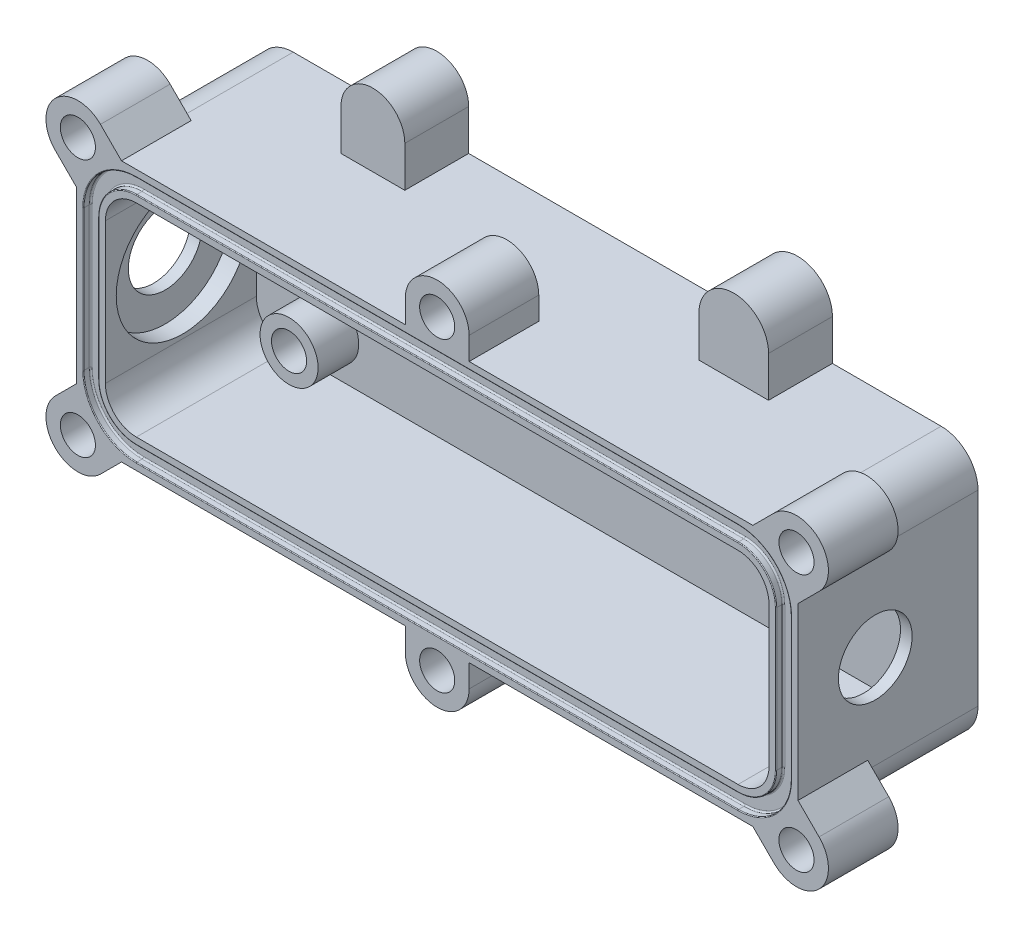
from build123d import *

# Parameters (mm, degrees)
SKETCH1_W               = 114.3
SKETCH1_H               = 34.925
BOSS_EXTRUDE1_DEPTH     = 26
SHELL1_T                = 5
FILLET1_R               = 5.334
FILLET2_R               = 6.35
CUT_EXTRUDE1_DEPTH      = 1.2446
FILLET3_R               = 0.254
FILLET4_R               = 0.127
BOSS_EXTRUDE3_START     = -12
BOSS_EXTRUDE3_DEPTH     = 12
SKETCH5_R               = 3.025
CUT_EXTRUDE3_DEPTH      = 9
MIRROR2_START           = -12
MIRROR2_COPY_1_DEPTH    = 12
MIRROR2_COPY_2_SKETCH_R = 3.025
MIRROR2_COPY_2_DEPTH    = 9
BOSS_EXTRUDE4_DEPTH     = 12
SKETCH7_R               = 3.025
CUT_EXTRUDE4_DEPTH      = 9
CUT_EXTRUDE5_DEPTH      = 6
SKETCH10_R              = 5
SKETCH10_R_2            = 3.025
BOSS_EXTRUDE5_DEPTH     = 7
SKETCH11_R              = 11.43
CUT_EXTRUDE6_DEPTH      = 3
SKETCH12_R              = 6
SKETCH12_R_2            = 3.025
SKETCH12_R_3            = 5.5
BOSS_EXTRUDE6_DEPTH     = 11
SKETCH13_R              = 3.025
CUT_EXTRUDE7_DEPTH      = 9


with BuildPart() as part:
    # Sketch1 → Boss-Extrude1 (new body)
    with BuildSketch(Plane.XY):
        Rectangle(SKETCH1_W, SKETCH1_H)
    extrude(amount=BOSS_EXTRUDE1_DEPTH)

    # Shell1
    shell1_openings = [part.faces().sort_by_distance(p)[0] for p in [
        (0, 0, 26),
    ]]
    offset(amount=SHELL1_T, openings=shell1_openings, kind=Kind.INTERSECTION)

    # Fillet1
    # the kernel refuses this fillet: 5.334 mm, written as the material it adds along each edge
    with BuildSketch(Plane(origin=(57.15, -17.4625, 0), x_dir=(0, 1, 0), z_dir=(0, 0, 1)), Plane(origin=(57.15, 17.4625, 0), x_dir=(-1, 0, 0), z_dir=(0, 0, 1)), Plane(origin=(-57.15, -17.4625, 0), x_dir=(1, 0, 0), z_dir=(0, 0, 1))) as fillet1_piece_1:
        with BuildLine():
            CenterArc((FILLET1_R, FILLET1_R), FILLET1_R, 180, 90)
            Line((0, FILLET1_R), (0, 0))
            Line((0, 0), (FILLET1_R, 0))
        make_face()
    extrude(amount=26)
    with BuildSketch(Plane(origin=(-57.15, 17.4625, 0), x_dir=(1, 0, 0), z_dir=(0, 0, 1))) as fillet1_piece_2:
        with BuildLine():
            CenterArc((FILLET1_R, -FILLET1_R), FILLET1_R, 90, 90)
            Line((0, -FILLET1_R), (0, 0))
            Line((0, 0), (FILLET1_R, 0))
        make_face()
    extrude(amount=26)

    # Fillet2
    fillet2_edges = [part.edges().sort_by_distance(p)[0] for p in [
        (62.15, -22.4625, 10.5),
        (-62.15, -22.4625, 10.5),
        (-62.15, 22.4625, 10.5),
        (62.15, 22.4625, 10.5),
    ]]
    fillet(fillet2_edges, radius=FILLET2_R)

    # Sketch2 → Cut-Extrude1 (cut)
    with BuildSketch(Plane.XY.offset(26)):
        with BuildLine():
            Line((-60.9327, 12.1285), (-60.9327, -12.1285))
            ThreePointArc((-60.9327, -12.1285), (-58.262480392, -18.574980392), (-51.816, -21.2452))
            Line((-51.816, -21.2452), (51.816, -21.2452))
            ThreePointArc((51.816, -21.2452), (58.262480392, -18.574980392), (60.9327, -12.1285))
            Line((60.9327, -12.1285), (60.9327, 12.1285))
            ThreePointArc((60.9327, 12.1285), (58.262480392, 18.574980392), (51.816, 21.2452))
            Line((51.816, 21.2452), (-51.816, 21.2452))
            ThreePointArc((-51.816, 21.2452), (-58.262480392, 18.574980392), (-60.9327, 12.1285))
        make_face()
        with BuildLine():
            Line((51.816, 18.6798), (-51.816, 18.6798))
            ThreePointArc((-51.816, 18.6798), (-56.448468656, 16.760968656), (-58.3673, 12.1285))
            Line((-58.3673, 12.1285), (-58.3673, -12.1285))
            ThreePointArc((-58.3673, -12.1285), (-56.448468656, -16.760968656), (-51.816, -18.6798))
            Line((-51.816, -18.6798), (51.816, -18.6798))
            ThreePointArc((51.816, -18.6798), (56.448468656, -16.760968656), (58.3673, -12.1285))
            Line((58.3673, -12.1285), (58.3673, 12.1285))
            ThreePointArc((58.3673, 12.1285), (56.448468656, 16.760968656), (51.816, 18.6798))
        make_face(mode=Mode.SUBTRACT)
    extrude(amount=-CUT_EXTRUDE1_DEPTH, mode=Mode.SUBTRACT)

    # Fillet3
    fillet3_edges = [part.edges().sort_by_distance(p)[0] for p in [
        (-58.262480392, 18.574980392, 24.7554),
        (0, 21.2452, 24.7554),
        (58.262480392, 18.574980392, 24.7554),
        (60.9327, 0, 24.7554),
        (58.262480392, -18.574980392, 24.7554),
        (0, -21.2452, 24.7554),
        (-58.262480392, -18.574980392, 24.7554),
        (-60.9327, 0, 24.7554),
        (58.3673, 0, 24.7554),
        (56.448468656, 16.760968656, 24.7554),
        (0, 18.6798, 24.7554),
        (-56.448468656, 16.760968656, 24.7554),
        (-58.3673, 0, 24.7554),
        (-56.448468656, -16.760968656, 24.7554),
        (0, -18.6798, 24.7554),
        (56.448468656, -16.760968656, 24.7554),
    ]]
    fillet(fillet3_edges, radius=FILLET3_R)

    # Fillet4
    fillet4_edges = [part.edges().sort_by_distance(p)[0] for p in [
        (-58.262480392, 18.574980392, 26),
        (-60.9327, 0, 26),
        (-58.262480392, -18.574980392, 26),
        (0, -21.2452, 26),
        (58.262480392, -18.574980392, 26),
        (60.9327, 0, 26),
        (58.262480392, 18.574980392, 26),
        (0, 21.2452, 26),
        (56.448468656, 16.760968656, 26),
        (58.3673, 0, 26),
        (56.448468656, -16.760968656, 26),
        (0, -18.6798, 26),
        (-56.448468656, -16.760968656, 26),
        (-58.3673, 0, 26),
        (-56.448468656, 16.760968656, 26),
        (0, 18.6798, 26),
    ]]
    fillet(fillet4_edges, radius=FILLET4_R)

    # Sketch4 → Boss-Extrude3 (add)
    with BuildSketch(Plane.XY.offset(26).offset(BOSS_EXTRUDE3_START)):
        with BuildLine():
            ThreePointArc((62.15, -16.1125), (61.666635031, -18.542539796), (60.290128061, -20.602628061))
            ThreePointArc((60.290128061, -20.602628061), (58.230039796, -21.979135031), (55.8, -22.4625))
            Line((55.8, -22.4625), (54.371825407, -22.4625))
            Line((54.371825407, -22.4625), (57.998729563, -26.089404156))
            ThreePointArc((57.998729563, -26.089404156), (65.776904156, -26.089404156), (65.776904156, -18.311229563))
            Line((65.776904156, -18.311229563), (62.15, -14.684325407))
            Line((62.15, -14.684325407), (62.15, -16.1125))
        make_face()
    boss_extrude3 = extrude(amount=BOSS_EXTRUDE3_DEPTH)

    # Sketch5 → Cut-Extrude3 (cut)
    with BuildSketch(Plane.XY.offset(26)):
        with Locations((61.887816859, -22.200316859)):
            Circle(SKETCH5_R)
    cut_extrude3 = extrude(amount=-CUT_EXTRUDE3_DEPTH, mode=Mode.SUBTRACT)

    # Mirror1: Boss-Extrude3, Cut-Extrude3 across plane
    add(boss_extrude3.mirror(Plane.ZX))
    add(cut_extrude3.mirror(Plane.ZX), mode=Mode.SUBTRACT)

    # Mirror2: Boss-Extrude3, Cut-Extrude3 across plane
    add(boss_extrude3.mirror(Plane(origin=(0, 0, 0), x_dir=(0, 0, 1), z_dir=(1, 0, 0))))
    add(cut_extrude3.mirror(Plane(origin=(0, 0, 0), x_dir=(0, 0, 1), z_dir=(1, 0, 0))), mode=Mode.SUBTRACT)

    # Mirror2 copy 1 sketch → Mirror2 copy 1 (add)
    with BuildSketch(Plane(origin=(0, 0, 26), x_dir=(-1, 0, 0), z_dir=(0, 0, 1)).offset(MIRROR2_START)):
        with BuildLine():
            ThreePointArc((62.15, -16.1125), (61.666635031, -18.542539796), (60.290128061, -20.602628061))
            ThreePointArc((60.290128061, -20.602628061), (58.230039796, -21.979135031), (55.8, -22.4625))
            Line((55.8, -22.4625), (54.371825407, -22.4625))
            Line((54.371825407, -22.4625), (57.998729563, -26.089404156))
            ThreePointArc((57.998729563, -26.089404156), (65.776904156, -26.089404156), (65.776904156, -18.311229563))
            Line((65.776904156, -18.311229563), (62.15, -14.684325407))
            Line((62.15, -14.684325407), (62.15, -16.1125))
        make_face()
    extrude(amount=MIRROR2_COPY_1_DEPTH)

    # Mirror2 copy 2 sketch → Mirror2 copy 2 (cut)
    with BuildSketch(Plane(origin=(0, 0, 26), x_dir=(-1, 0, 0), z_dir=(0, 0, 1))):
        with Locations((61.887816859, -22.200316859)):
            Circle(MIRROR2_COPY_2_SKETCH_R)
    extrude(amount=-MIRROR2_COPY_2_DEPTH, mode=Mode.SUBTRACT)

    # Sketch6 → Boss-Extrude4 (add)
    with BuildSketch(Plane.XY.offset(26)):
        with BuildLine():
            Line((0, -22.4625), (-5.5, -22.4625))
            Line((-5.5, -22.4625), (-5.5, -26.3722))
            ThreePointArc((-5.5, -26.3722), (0, -31.8722), (5.5, -26.3722))
            Line((5.5, -26.3722), (5.5, -22.4625))
            Line((5.5, -22.4625), (0, -22.4625))
        make_face()
    boss_extrude4 = extrude(amount=-BOSS_EXTRUDE4_DEPTH)

    # Sketch7 → Cut-Extrude4 (cut)
    with BuildSketch(Plane.XY.offset(26)):
        with Locations((0, -26.3722)):
            Circle(SKETCH7_R)
    cut_extrude4 = extrude(amount=-CUT_EXTRUDE4_DEPTH, mode=Mode.SUBTRACT)

    # Mirror3: Boss-Extrude4, Cut-Extrude4 across plane
    add(boss_extrude4.mirror(Plane.ZX))
    add(cut_extrude4.mirror(Plane.ZX), mode=Mode.SUBTRACT)

    # Sketch9 → Cut-Extrude5 (cut)
    with BuildSketch(Plane(origin=(62.15, 0, 0), x_dir=(0, 0, -1), z_dir=(1, 0, 0))):
        with BuildLine():
            ThreePointArc((-19.05, 0), (-12.7, -6.35), (-6.35, 0))
            Line((-6.35, 0), (-19.05, 0))
        make_face()
        with BuildLine():
            Line((-19.05, 0), (-6.35, 0))
            ThreePointArc((-6.35, 0), (-12.7, 6.35), (-19.05, 0))
        make_face()
    cut_extrude5 = extrude(amount=-CUT_EXTRUDE5_DEPTH, mode=Mode.SUBTRACT)

    # Sketch10 → Boss-Extrude5 (add)
    # profile 1 of 3: a face of its own
    with BuildSketch(Plane.XY):
        with Locations((-44.513500214, 10.477500595)):
            Circle(SKETCH10_R)
        with Locations((-44.513500214, 10.477500595)):
            Circle(SKETCH10_R_2, mode=Mode.SUBTRACT)
    # profile 2 of 3: a face of its own
    with BuildSketch(Plane.XY):
        with Locations((-44.513500214, -10.477499405)):
            Circle(SKETCH10_R)
        with Locations((-44.513500214, -10.477499405)):
            Circle(SKETCH10_R_2, mode=Mode.SUBTRACT)
    # profile 3 of 3: a face of its own
    with BuildSketch(Plane.XY):
        with Locations((44.126499786, -0.097499405)):
            Circle(SKETCH10_R)
        with Locations((44.126499786, -0.097499405)):
            Circle(SKETCH10_R_2, mode=Mode.SUBTRACT)
    extrude(amount=BOSS_EXTRUDE5_DEPTH)

    # Sketch11 → Cut-Extrude6 (cut)
    with BuildSketch(Plane.ZY.offset(-57.15)):
        with Locations((12.7, 0)):
            Circle(SKETCH11_R)
    cut_extrude6 = extrude(amount=-CUT_EXTRUDE6_DEPTH, mode=Mode.SUBTRACT)

    # Mirror4: Cut-Extrude5, Cut-Extrude6 across plane
    add(cut_extrude5.mirror(Plane(origin=(0, 0, 0), x_dir=(0, 0, 1), z_dir=(1, 0, 0))), mode=Mode.SUBTRACT)
    add(cut_extrude6.mirror(Plane(origin=(0, 0, 0), x_dir=(0, 0, 1), z_dir=(1, 0, 0))), mode=Mode.SUBTRACT)

    # Sketch12 → Boss-Extrude6 (add)
    # profile 1 of 6: a face of its own
    with BuildSketch(Plane(origin=(0, 0, -5), x_dir=(-1, 0, 0), z_dir=(0, 0, -1))):
        with BuildLine():
            Line((-37.075, 29.4625), (-37.075, 22.4625))
            Line((-37.075, 22.4625), (-31.075, 22.4625))
            Line((-31.075, 22.4625), (-25.075, 22.4625))
            Line((-25.075, 22.4625), (-25.075, 29.4625))
            ThreePointArc((-25.075, 29.4625), (-31.075, 23.4625), (-37.075, 29.4625))
        make_face()
    # profile 2 of 6: a face of its own
    with BuildSketch(Plane(origin=(0, 0, -5), x_dir=(-1, 0, 0), z_dir=(0, 0, -1))):
        with Locations((-31.075, 29.4625)):
            Circle(SKETCH12_R)
        with Locations((-31.075, 29.4625)):
            Circle(SKETCH12_R_2, mode=Mode.SUBTRACT)
    # profile 3 of 6: a face of its own
    with BuildSketch(Plane(origin=(0, 0, -5), x_dir=(-1, 0, 0), z_dir=(0, 0, -1))):
        with Locations((-31.075, 29.4625)):
            Circle(SKETCH12_R_2)
    # profile 4 of 6: a face of its own
    with BuildSketch(Plane(origin=(0, 0, -5), x_dir=(-1, 0, 0), z_dir=(0, 0, -1))):
        with BuildLine():
            Line((25.575, 29.4625), (25.575, 22.4625))
            Line((25.575, 22.4625), (36.575, 22.4625))
            Line((36.575, 22.4625), (36.575, 29.4625))
            ThreePointArc((36.575, 29.4625), (31.075, 23.9625), (25.575, 29.4625))
        make_face()
    # profile 5 of 6: a face of its own
    with BuildSketch(Plane(origin=(0, 0, -5), x_dir=(-1, 0, 0), z_dir=(0, 0, -1))):
        with Locations((31.075, 29.4625)):
            Circle(SKETCH12_R_3)
        with Locations((31.075, 29.4625)):
            Circle(SKETCH12_R_2, mode=Mode.SUBTRACT)
    # profile 6 of 6: a face of its own
    with BuildSketch(Plane(origin=(0, 0, -5), x_dir=(-1, 0, 0), z_dir=(0, 0, -1))):
        with Locations((31.075, 29.4625)):
            Circle(SKETCH12_R_2)
    extrude(amount=-BOSS_EXTRUDE6_DEPTH)

    # Sketch13 → Cut-Extrude7 (cut)
    with BuildSketch(Plane(origin=(0, 0, -5), x_dir=(-1, 0, 0), z_dir=(0, 0, -1))):
        with Locations((-31.075, 29.4625)):
            Circle(SKETCH13_R)
        with Locations((31.075, 29.4625)):
            Circle(SKETCH13_R)
    extrude(amount=-CUT_EXTRUDE7_DEPTH, mode=Mode.SUBTRACT)


solid = part.part
